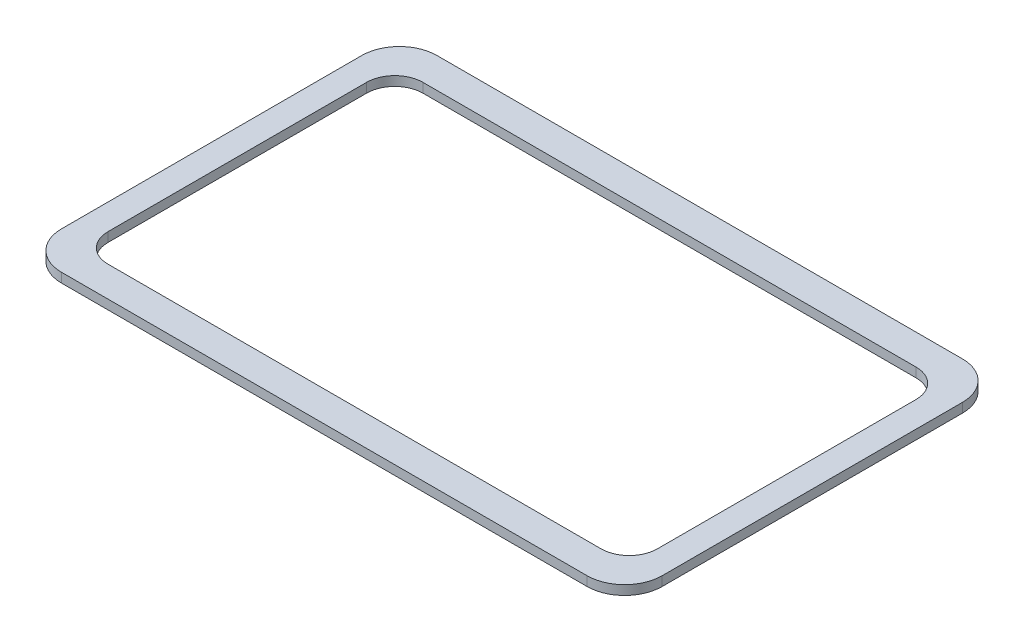
from build123d import *

# Parameters (mm, degrees)
MAINBODY_DEPTH = 3.175


with BuildPart() as part:
    # Sketch2 → MainBody (new body)
    with BuildSketch(Plane(origin=(0, 49.342738419, 0), x_dir=(1, 0, 0), z_dir=(0, 1, 0))):
        with BuildLine():
            Line((74.712473168, 86.646627483), (-103.087526832, 86.646627483))
            ThreePointArc((-103.087526832, 86.646627483), (-112.067782953, 82.926883604), (-115.787526832, 73.946627483))
            Line((-115.787526832, 73.946627483), (-115.787526832, -27.653372517))
            ThreePointArc((-115.787526832, -27.653372517), (-112.067782953, -36.633628639), (-103.087526832, -40.353372517))
            Line((-103.087526832, -40.353372517), (74.712473168, -40.353372517))
            ThreePointArc((74.712473168, -40.353372517), (83.692729289, -36.633628639), (87.412473168, -27.653372517))
            Line((87.412473168, -27.653372517), (87.412473168, 73.946627483))
            ThreePointArc((87.412473168, 73.946627483), (83.692729289, 82.926883604), (74.712473168, 86.646627483))
        make_face()
        with BuildLine():
            Line((-97.584301976, -30.115902517), (69.209248312, -30.115902517))
            ThreePointArc((69.209248312, -30.115902517), (75.943542377, -27.326466583), (78.732978312, -20.592172517))
            Line((78.732978312, -20.592172517), (78.732978312, 66.885427483))
            ThreePointArc((78.732978312, 66.885427483), (75.943542377, 73.619721548), (69.209248312, 76.409157483))
            Line((69.209248312, 76.409157483), (-97.584301976, 76.409157483))
            ThreePointArc((-97.584301976, 76.409157483), (-104.318596042, 73.619721548), (-107.108031976, 66.885427483))
            Line((-107.108031976, 66.885427483), (-107.108031976, 23.146627483))
            Line((-107.108031976, 23.146627483), (-107.108031976, -20.592172517))
            ThreePointArc((-107.108031976, -20.592172517), (-104.318596042, -27.326466583), (-97.584301976, -30.115902517))
        make_face(mode=Mode.SUBTRACT)
    extrude(amount=MAINBODY_DEPTH)


solid = part.part
